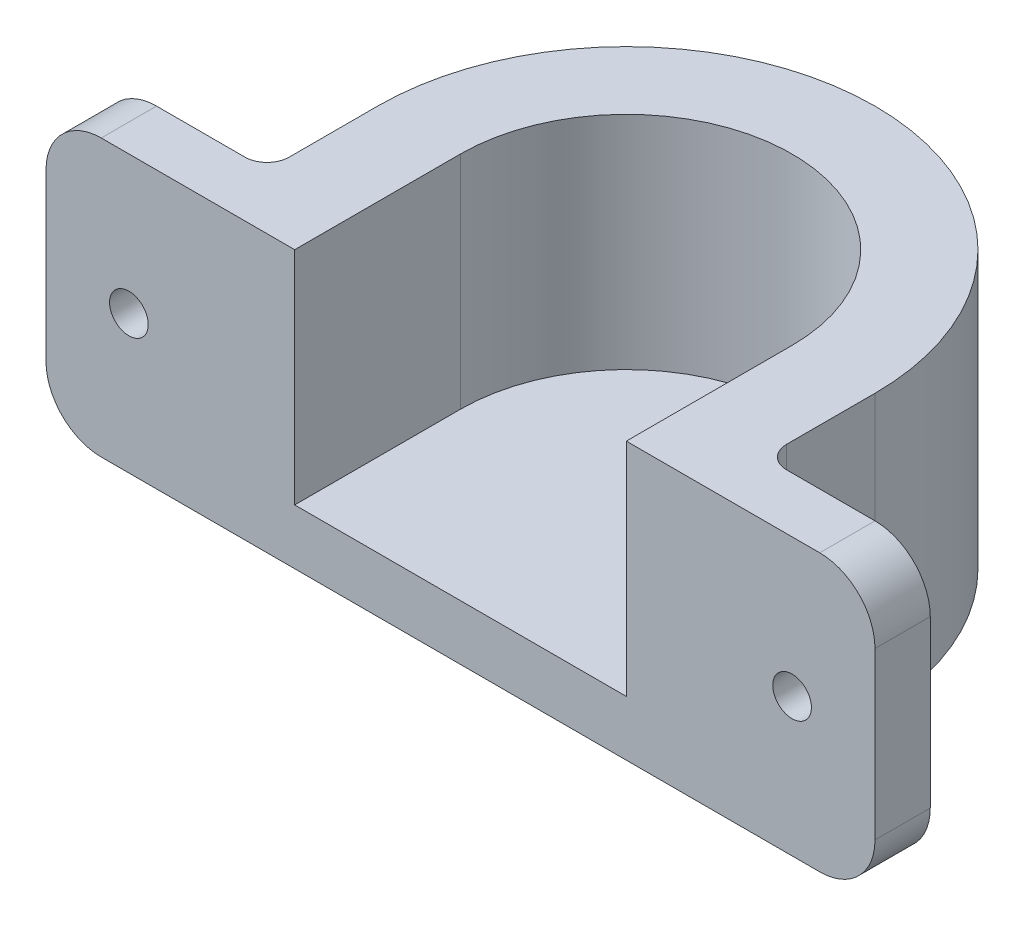
from build123d import *

# Parameters (mm, degrees)
BOSS_EXTRUDE1_DEPTH = 25
SKETCH4_R           = 1.75
CUT_EXTRUDE1_DEPTH  = 67.614562972
FILLET1_R           = 5
FILLET2_R           = 2
SKETCH5_W           = 30
SKETCH5_H           = 5
BOSS_EXTRUDE2_DEPTH = 31


with BuildPart() as part:
    # Sketch1 → Boss-Extrude1 (new body)
    with BuildSketch(Plane(origin=(0, 0, 0), x_dir=(1, 0, 0), z_dir=(0, 1, 0))):
        with BuildLine():
            Line((-7.5, 0), (-7.5, -10))
            Line((-7.5, -10), (-22.5, -10))
            Line((-22.5, -10), (-22.5, -15))
            Line((-22.5, -15), (0, -15))
            Line((0, -15), (0, 0))
            ThreePointArc((0, 0), (15, 15), (30, 0))
            Line((30, 0), (30, -15))
            Line((30, -15), (52.5, -15))
            Line((52.5, -15), (52.5, -10))
            Line((52.5, -10), (37.5, -10))
            Line((37.5, -10), (37.5, 0))
            ThreePointArc((37.5, 0), (15, 22.5), (-7.5, 0))
        make_face()
    extrude(amount=BOSS_EXTRUDE1_DEPTH)

    # Sketch4 → Cut-Extrude1 (cut, through all)
    with BuildSketch(Plane(origin=(0, 0, 10), x_dir=(-1, 0, 0), z_dir=(0, 0, -1))):
        with Locations((-45, 12.5)):
            Circle(SKETCH4_R)
        with Locations((15, 12.5)):
            Circle(SKETCH4_R)
    extrude(amount=-CUT_EXTRUDE1_DEPTH, mode=Mode.SUBTRACT)

    # Fillet1
    fillet1_edges = [part.edges().sort_by_distance(p)[0] for p in [
        (52.5, 25, 12.5),
        (52.5, 0, 12.5),
        (-22.5, 25, 12.5),
        (-22.5, 0, 12.5),
    ]]
    fillet(fillet1_edges, radius=FILLET1_R)

    # Fillet2
    fillet2_edges = [part.edges().sort_by_distance(p)[0] for p in [
        (37.5, 12.5, 10),
        (-7.5, 12.5, 10),
    ]]
    fillet(fillet2_edges, radius=FILLET2_R)

    # Sketch5 → Boss-Extrude2 (add)
    with BuildSketch(Plane.XY.offset(15)):
        with Locations((15, 2.5)):
            Rectangle(SKETCH5_W, SKETCH5_H)
    extrude(amount=-BOSS_EXTRUDE2_DEPTH)


solid = part.part
